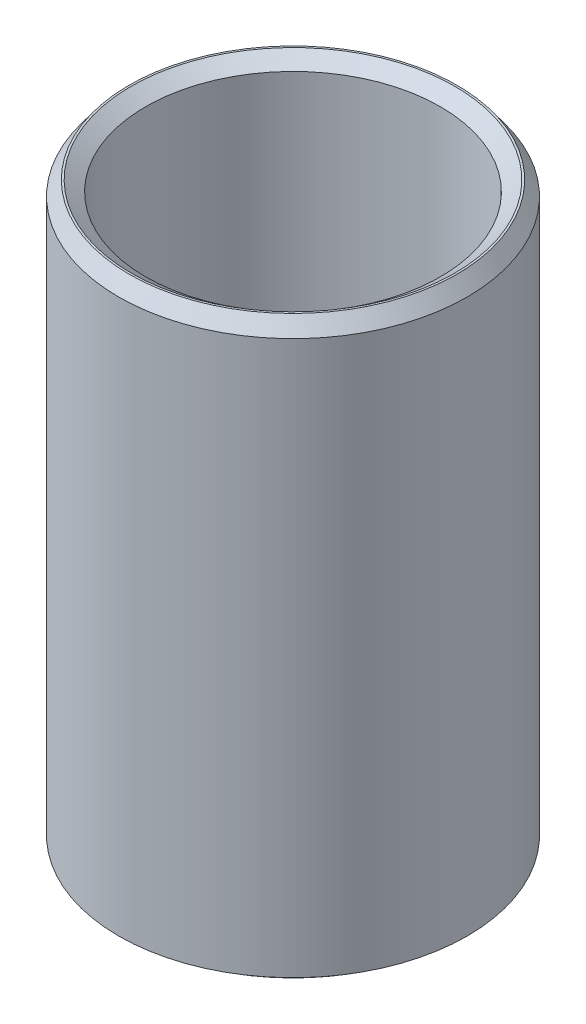
from build123d import *
from OCP.BRepFilletAPI import BRepFilletAPI_MakeChamfer

# Parameters (mm, degrees)
SKETCH1_R           = 27.5
BOSS_EXTRUDE1_DEPTH = 91.25190375
SKETCH2_R           = 23.256558876
CUT_EXTRUDE1_DEPTH  = 100.193799897
CHAMFER1_SIZE       = 2.279217378
CHAMFER1_SIZE2      = 1.649634199


with BuildPart() as part:
    # Sketch1 → Boss-Extrude1 (new body)
    with BuildSketch(Plane(origin=(0, 0, 0), x_dir=(1, 0, 0), z_dir=(0, 1, 0))):
        Circle(SKETCH1_R)
    extrude(amount=BOSS_EXTRUDE1_DEPTH)

    # Sketch2 → Cut-Extrude1 (cut, through all)
    with BuildSketch(Plane(origin=(0, 0, 0), x_dir=(1, 0, 0), z_dir=(0, 1, 0))):
        Circle(SKETCH2_R)
    extrude(amount=CUT_EXTRUDE1_DEPTH, mode=Mode.SUBTRACT)

    # Chamfer1: one chamfer whose edges measure the first distance from different faces: ONE call of the kernel's chamfer builder (chamfer() names one face for all edges)
    chamfer1_edges_1 = [part.edges().sort_by_distance(p)[0] for p in [
        (-23.256558876, 91.25190375, 0),
    ]]
    chamfer1_side_1 = [part.faces().sort_by_distance(p)[0] for p in [
        (-26.722182541, 91.25190375, 0),
    ]]
    chamfer1_edges_2 = [part.edges().sort_by_distance(p)[0] for p in [
        (-23.256558876, 0, 0),
    ]]
    chamfer1_side_2 = [part.faces().sort_by_distance(p)[0] for p in [
        (-23.256558876, 45.625951875, 0),
    ]]
    chamfer1_edges_3 = [part.edges().sort_by_distance(p)[0] for p in [
        (-27.5, 0, 0),
    ]]
    chamfer1_side_3 = [part.faces().sort_by_distance(p)[0] for p in [
        (-26.722182541, 0, 0),
    ]]
    chamfer1_edges_4 = [part.edges().sort_by_distance(p)[0] for p in [
        (-27.5, 91.25190375, 0),
    ]]
    chamfer1_side_4 = [part.faces().sort_by_distance(p)[0] for p in [
        (-27.5, 45.625951875, 0),
    ]]
    chamfer1 = BRepFilletAPI_MakeChamfer(part.part.solid().wrapped)
    for e in chamfer1_edges_1:
        chamfer1.Add(CHAMFER1_SIZE, CHAMFER1_SIZE2, e.wrapped, chamfer1_side_1[0].wrapped)  # the first distance lies on this face
    for e in chamfer1_edges_2:
        chamfer1.Add(CHAMFER1_SIZE, CHAMFER1_SIZE2, e.wrapped, chamfer1_side_2[0].wrapped)  # the first distance lies on this face
    for e in chamfer1_edges_3:
        chamfer1.Add(CHAMFER1_SIZE, CHAMFER1_SIZE2, e.wrapped, chamfer1_side_3[0].wrapped)  # the first distance lies on this face
    for e in chamfer1_edges_4:
        chamfer1.Add(CHAMFER1_SIZE, CHAMFER1_SIZE2, e.wrapped, chamfer1_side_4[0].wrapped)  # the first distance lies on this face
    add(Compound.cast(chamfer1.Shape()), mode=Mode.REPLACE)


solid = part.part
